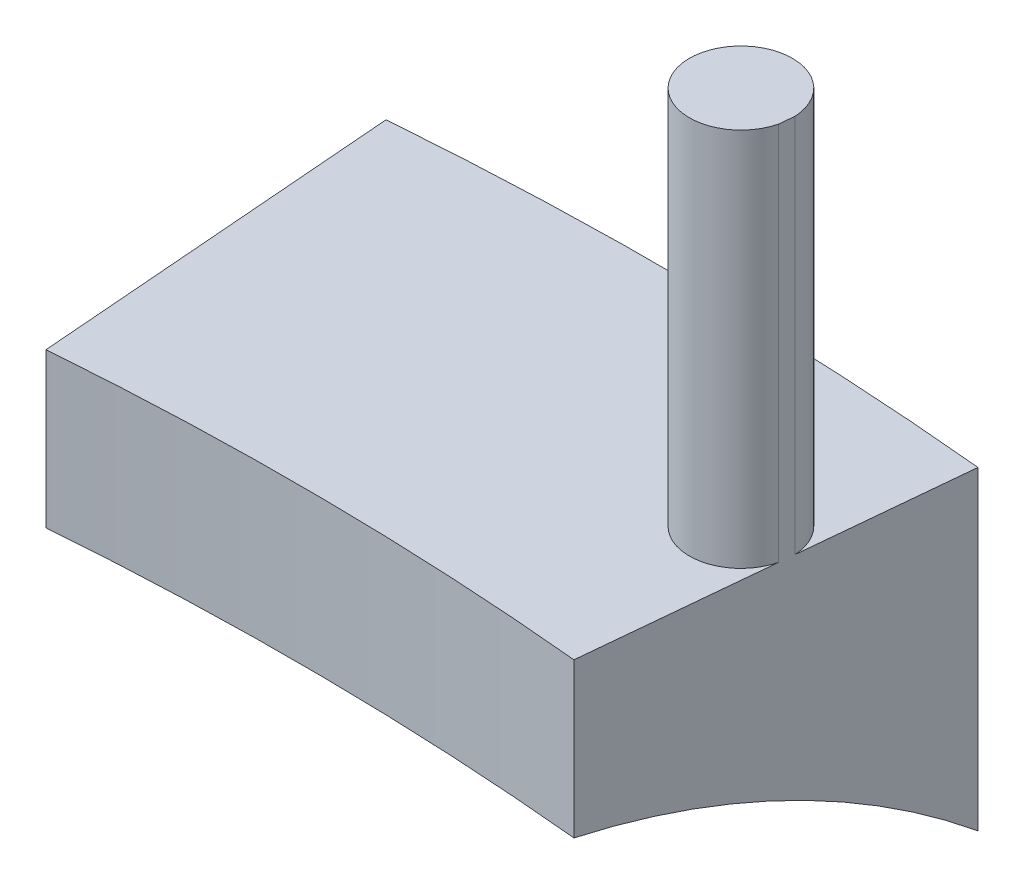
from build123d import *

# Parameters (mm, degrees)
SKETCH1_R           = 140.97
SKETCH1_R_2         = 125.73
BOSS_EXTRUDE1_DEPTH = 12.954
CUT_EXTRUDE1_START  = -12.954
CUT_EXTRUDE1_DEPTH  = 12.954
SKETCH5_R           = 2.1209
BOSS_EXTRUDE2_DEPTH = 28.575
SKETCH6_W           = 35.941656598
SKETCH6_H           = 50
CUT_EXTRUDE2_DEPTH  = 25.4


with BuildPart() as part:
    # Sketch1 → Boss-Extrude1 (new body)
    with BuildSketch(Plane(origin=(0, 0, 0), x_dir=(1, 0, 0), z_dir=(0, 1, 0))):
        Circle(SKETCH1_R)
        Circle(SKETCH1_R_2, mode=Mode.SUBTRACT)
    extrude(amount=BOSS_EXTRUDE1_DEPTH)

    # Sketch3 → Cut-Extrude1 (cut)
    with BuildSketch(Plane(origin=(0, 12.954, 0), x_dir=(1, 0, 0), z_dir=(0, 1, 0)).offset(CUT_EXTRUDE1_START)):
        with BuildLine():
            Line((0, 0), (-11.080200404, 140.53387513))
            ThreePointArc((-11.080200404, 140.53387513), (-1.210297371, -140.964804403), (13.491584054, 140.322906397))
            Line((13.491584054, 140.322906397), (0, 0))
        make_face()
    extrude(amount=CUT_EXTRUDE1_DEPTH, mode=Mode.SUBTRACT)

    # Sketch5 → Boss-Extrude2 (add)
    with BuildSketch(Plane(origin=(0, 0, 0), x_dir=(1, 0, 0), z_dir=(0, 1, 0))):
        with Locations((10.71230924, 133.345085246)):
            Circle(SKETCH5_R)
    extrude(amount=BOSS_EXTRUDE2_DEPTH)

    # Sketch2 → Cut-Revolve1 (revolve, cut)
    with BuildSketch(Plane.XY):
        with BuildLine():
            Line((-125.73, 6.604), (-125.73, 0))
            Line((-125.73, 0), (-140.97, 0))
            ThreePointArc((-140.97, 0), (-133.78949329, 4.316215284), (-125.73, 6.604))
        make_face()
    revolve(axis=Axis((0, 0, 0), (0, 1, 0)), mode=Mode.SUBTRACT)

    # Sketch6 → Cut-Extrude2 (cut)
    with BuildSketch(Plane(origin=(0, 0, 0), x_dir=(0.09570535612916914, 0, -0.9954097070092239), z_dir=(0.995409707009224, 0, 0.09570535612916914))):
        with Locations((132.91957607, 23.563430101)):
            Rectangle(SKETCH6_W, SKETCH6_H)
    extrude(amount=CUT_EXTRUDE2_DEPTH, mode=Mode.SUBTRACT)


solid = part.part
